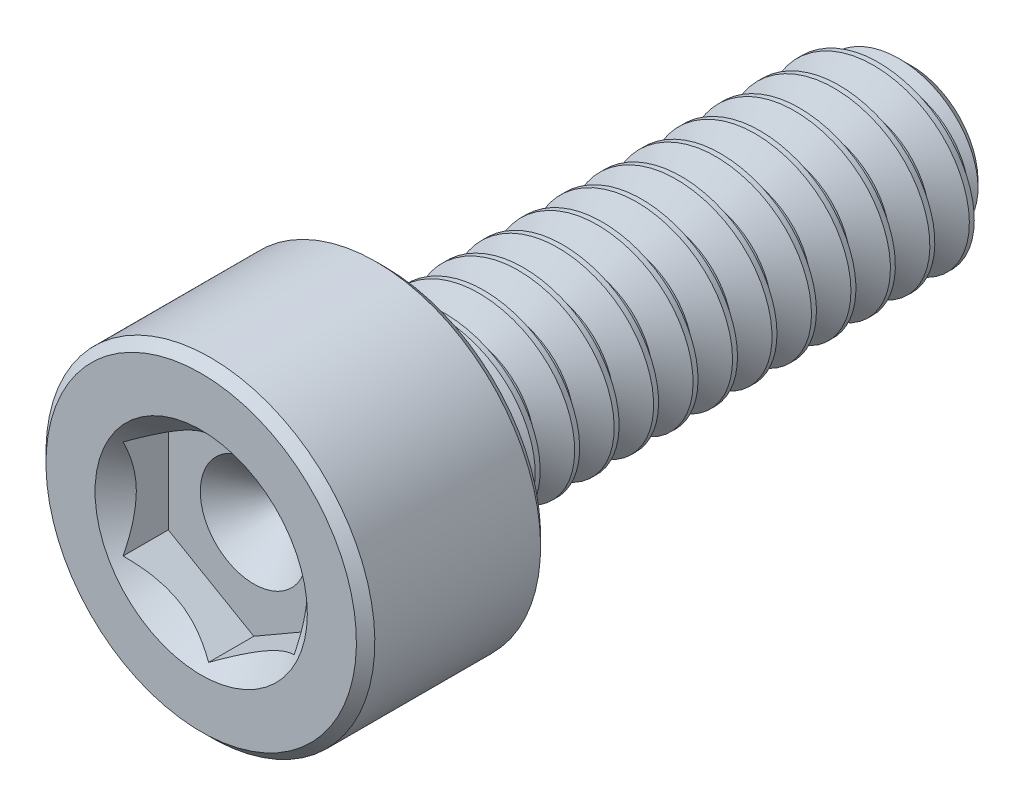
from build123d import *

# Parameters (mm, degrees)
CUT_EXTRUDE1_DEPTH     = 0.4
SKETCH4_R              = 0.806847001
CUT_EXTRUDE2_DEPTH     = 0.7
CUT_EXTRUDE2_DRAFT     = -45
SPLIT1_SURFACE_1_BACK  = 7.454
SPLIT1_SURFACE_1_DEPTH = 14.908
SPLIT1_SURFACE_2_BACK  = 7.454
SPLIT1_SURFACE_2_DEPTH = 14.908
CUT_SWEEP1_PITCH       = 0.3


with BuildPart() as part:
    # Sketch2 → Revolve1 (revolve)
    with BuildSketch(Plane(origin=(0, 0, 0), x_dir=(0, 0, -1), z_dir=(1, 0, 0))):
        with BuildLine():
            Line((-2.7, 0), (-2.7, 1.18))
            Line((-2.7, 1.18), (-2.63, 1.25))
            Line((-2.63, 1.25), (-1.37, 1.25))
            Line((-1.37, 1.25), (-1.3, 1.18))
            Line((-1.3, 1.18), (-1.3, 0.77))
            ThreePointArc((-1.3, 0.77), (-1.279497475, 0.720502525), (-1.23, 0.7))
            Line((-1.23, 0.7), (2.505144284, 0.7))
            Line((2.505144284, 0.7), (2.7, 0.505144284))
            Line((2.7, 0.505144284), (2.7, 0))
            Line((2.7, 0), (-2.7, 0))
        make_face()
    revolve(axis=Axis((0, 0, -2.7), (0, 0, 1)))

    # Sketch3 → Cut-Extrude1 (cut)
    with BuildSketch(Plane.XY.offset(2.7)):
        Polygon((0.65, -0.375277675), (0.65, 0.375277675), (0, 0.75055535), (-0.65, 0.375277675), (-0.65, -0.375277675), (0, -0.75055535), align=None)
    extrude(amount=-CUT_EXTRUDE1_DEPTH, mode=Mode.SUBTRACT)


with BuildPart() as cut_extrude2_tool:
    # Sketch4 → Cut-Extrude2 (with draft: the straight prism first)
    with BuildSketch(Plane.XY.offset(2.7)):
        Circle(SKETCH4_R)
    extrude(amount=-CUT_EXTRUDE2_DEPTH)
    # Cut-Extrude2: the draft: its side faces are tilted about the plane it starts from
    cut_extrude2_sides = [cut_extrude2_tool.faces().sort_by_distance(p)[0] for p in [
        (-0.806847001, 0, 2.35),
    ]]
    draft(cut_extrude2_sides, Plane.XY.offset(2.7), CUT_EXTRUDE2_DRAFT)


with BuildPart() as part_1:
    add(part.part)

    # Cut-Extrude2: cut by cut_extrude2_tool
    add(cut_extrude2_tool.part, mode=Mode.SUBTRACT)


with BuildPart() as body_2:
    # Split1: the piece behind the surface
    add(part_1.part)
    # Split1 surface: a surface, the sketch's curves swept straight by 14.908 mm
    with BuildLine(Plane(origin=(0, 0, 0), x_dir=(0, 0, -1), z_dir=(1, 0, 0)).offset(-SPLIT1_SURFACE_1_BACK), mode=Mode.PRIVATE) as split1_surface_1_path:
        Line((-1.23, -1.25), (-1.23, 1.25))
    split1_surface_1 = Shell.extrude(split1_surface_1_path.wire(), (1 * SPLIT1_SURFACE_1_DEPTH, 0 * SPLIT1_SURFACE_1_DEPTH, 0 * SPLIT1_SURFACE_1_DEPTH))
    split(bisect_by=split1_surface_1, keep=Keep.BOTTOM)

    # Cut-Sweep1: the profile of Sketch7 screwed along a right-hand helix of 14.333333 turns, 6 arcs to a turn; built about Z, then put on its axis
    cut_sweep1_z = Axis((0, 0, 0), (0, 0, 1))
    cut_sweep1_corners = [(0.716237976, 0, 0.009375), (0.716237976, 0, -0.271875), (0.505144284, 0, -0.15), (0.505144284, 0, -0.1125)]
    with BuildLine(mode=Mode.PRIVATE) as cut_sweep1_profile:
        Line(cut_sweep1_corners[0], cut_sweep1_corners[1])
        Line(cut_sweep1_corners[1], cut_sweep1_corners[2])
        Line(cut_sweep1_corners[2], cut_sweep1_corners[3])
        Line(cut_sweep1_corners[3], cut_sweep1_corners[0])
    cut_sweep1_cap = Face(cut_sweep1_profile.wire())
    cut_sweep1_turn_angles = [0, 30, 60, 90, 120, 150, 180, 210, 240, 270, 300, 330, 360]
    cut_sweep1_turn_weights = [1, 0.8660254037844387, 1, 0.8660254037844387, 1, 0.8660254037844387, 1, 0.8660254037844387, 1, 0.8660254037844387, 1, 0.8660254037844387, 1]
    cut_sweep1_turn_rails = [Edge.make_bspline([Vector(p[0], p[1], 0).rotate(cut_sweep1_z, cut_sweep1_turn_angles[k]) / cut_sweep1_turn_weights[k] + Vector(0, 0, p[2] + CUT_SWEEP1_PITCH * cut_sweep1_turn_angles[k] / 360) for k in range(13)], [0, 0, 0, 1, 1, 2, 2, 3, 3, 4, 4, 5, 5, 6, 6, 6], 2, cut_sweep1_turn_weights) for p in cut_sweep1_corners]
    cut_sweep1_turn_sides = [Face.make_surface_from_curves(cut_sweep1_turn_rails[p[0]], cut_sweep1_turn_rails[p[1]]) for p in [(0, 1), (1, 2), (2, 3), (3, 0)]]
    cut_sweep1_last_angles = [5040, 5070, 5100, 5130, 5160]
    cut_sweep1_last_weights = [1, 0.8660254037844387, 1, 0.8660254037844426, 1]
    cut_sweep1_last_rails = [Edge.make_bspline([Vector(p[0], p[1], 0).rotate(cut_sweep1_z, cut_sweep1_last_angles[k]) / cut_sweep1_last_weights[k] + Vector(0, 0, p[2] + CUT_SWEEP1_PITCH * cut_sweep1_last_angles[k] / 360) for k in range(5)], [0, 0, 0, 1, 1, 2, 2, 2], 2, cut_sweep1_last_weights) for p in cut_sweep1_corners]
    cut_sweep1_last_sides = [Face.make_surface_from_curves(cut_sweep1_last_rails[p[0]], cut_sweep1_last_rails[p[1]]) for p in [(0, 1), (1, 2), (2, 3), (3, 0)]]
    cut_sweep1 = Plane(origin=(0, 0, -2.7), x_dir=(0, 1, 0), z_dir=(0, 0, 1)) * Solid(Shell([*[p.moved(Location((0, 0, CUT_SWEEP1_PITCH * i))) for i in range(14) for p in cut_sweep1_turn_sides], *cut_sweep1_last_sides, cut_sweep1_cap, cut_sweep1_cap.rotate(cut_sweep1_z, 5160).moved(Location((0, 0, CUT_SWEEP1_PITCH * 5160 / 360)))]))
    add(cut_sweep1, mode=Mode.SUBTRACT)


with BuildPart() as part_2:
    add(part_1.part)

    # Split1: split by a surface, the side it looks to stays
    # Split1 surface: a surface, the sketch's curves swept straight by 14.908 mm
    with BuildLine(Plane(origin=(0, 0, 0), x_dir=(0, 0, -1), z_dir=(1, 0, 0)).offset(-SPLIT1_SURFACE_2_BACK), mode=Mode.PRIVATE) as split1_surface_2_path:
        Line((-1.23, -1.25), (-1.23, 1.25))
    split1_surface_2 = Shell.extrude(split1_surface_2_path.wire(), (1 * SPLIT1_SURFACE_2_DEPTH, 0 * SPLIT1_SURFACE_2_DEPTH, 0 * SPLIT1_SURFACE_2_DEPTH))
    split(bisect_by=split1_surface_2, keep=Keep.TOP)

    add(body_2.part)  # Revolve2 merges body 2
    # Sketch8 → Revolve2 (revolve)
    with BuildSketch(Plane(origin=(0, 0, 0), x_dir=(0, 0, -1), z_dir=(1, 0, 0)), mode=Mode.PRIVATE) as revolve2_sk:
        Polygon((-1.3, 0), (-1.3, 0.7), (-1.23, 0.7), (-0.825854812, 0), align=None)
    revolve(revolve2_sk.sketch.rotate(Axis((0, 0, 0.825854812), (0, 0, 1)), 270), axis=Axis((0, 0, 0.825854812), (0, 0, 1)))


solid = part_2.part
